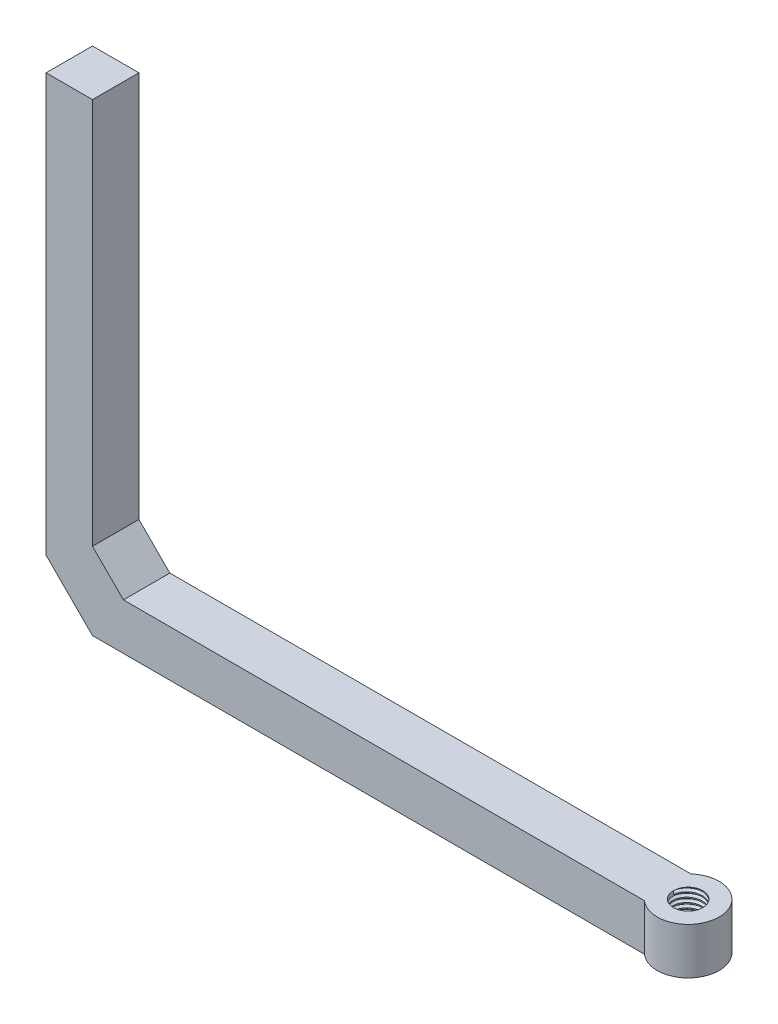
from build123d import *

# Parameters (mm, degrees)
BOSS_EXTRUDE3_DEPTH = 15
SKETCH5_R           = 10
BOSS_EXTRUDE4_DEPTH = 15
SKETCH6_R           = 4.75
CUT_EXTRUDE1_DEPTH  = 15
THREAD1_PITCH       = 1.5


with BuildPart() as part:
    # Sketch1 → Boss-Extrude3 (new body)
    with BuildSketch(Plane.XY):
        Polygon((0, 0), (0, 15), (-175, 15), (-185, 25), (-185, 150), (-200, 150), (-200, 15), (-185, 0), align=None)
    extrude(amount=BOSS_EXTRUDE3_DEPTH)

    # Sketch5 → Boss-Extrude4 (add)
    with BuildSketch(Plane(origin=(0, 0, 0), x_dir=(1, 0, 0), z_dir=(0, 1, 0))):
        with Locations((0, -7.5)):
            Circle(SKETCH5_R)
    extrude(amount=BOSS_EXTRUDE4_DEPTH)

    # Sketch6 → Cut-Extrude1 (cut)
    with BuildSketch(Plane(origin=(0, 15, 0), x_dir=(1, 0, 0), z_dir=(0, 1, 0))):
        with Locations(Location((0, -7.5, 0), (0, 0, 180))):
            Circle(SKETCH6_R)
    extrude(amount=-CUT_EXTRUDE1_DEPTH, mode=Mode.SUBTRACT)

    # Thread1: the profile of Thread Profile2 profile screwed along a right-hand helix of 10 turns, 8 arcs to a turn; built about Z, then put on its axis
    thread1_z = Axis((0, 0, 0), (0, 0, 1))
    thread1_corners = [(4.7497, 0, -0.000173205), (5.561898812, 0, 0.468749998), (5.561898812, 0, 0.656249998), (4.7497, 0, 1.125173201)]
    with BuildLine(mode=Mode.PRIVATE) as thread1_profile:
        Line(thread1_corners[0], thread1_corners[1])
        Line(thread1_corners[1], thread1_corners[2])
        Line(thread1_corners[2], thread1_corners[3])
        Line(thread1_corners[3], thread1_corners[0])
    thread1_cap = Face(thread1_profile.wire())
    thread1_turn_angles = [0, 22.5, 45, 67.5, 90, 112.5, 135, 157.5, 180, 202.5, 225, 247.5, 270, 292.5, 315, 337.5, 360]
    thread1_turn_weights = [1, 0.9238795325112867, 1, 0.9238795325112867, 1, 0.9238795325112867, 1, 0.9238795325112867, 1, 0.9238795325112867, 1, 0.9238795325112867, 1, 0.9238795325112867, 1, 0.9238795325112867, 1]
    thread1_turn_rails = [Edge.make_bspline([Vector(p[0], p[1], 0).rotate(thread1_z, thread1_turn_angles[k]) / thread1_turn_weights[k] + Vector(0, 0, p[2] + THREAD1_PITCH * thread1_turn_angles[k] / 360) for k in range(17)], [0, 0, 0, 1, 1, 2, 2, 3, 3, 4, 4, 5, 5, 6, 6, 7, 7, 8, 8, 8], 2, thread1_turn_weights) for p in thread1_corners]
    thread1_turn_sides = [Face.make_surface_from_curves(thread1_turn_rails[p[0]], thread1_turn_rails[p[1]]) for p in [(0, 1), (1, 2), (2, 3), (3, 0)]]
    thread1 = Plane(origin=(0, 15, 7.5), x_dir=(-1, 0, 0), z_dir=(0, -1, 0)) * Solid(Shell([*[p.moved(Location((0, 0, THREAD1_PITCH * i))) for i in range(10) for p in thread1_turn_sides], thread1_cap, thread1_cap.rotate(thread1_z, 3600).moved(Location((0, 0, THREAD1_PITCH * 3600 / 360)))]))
    add(thread1, mode=Mode.SUBTRACT)


solid = part.part
